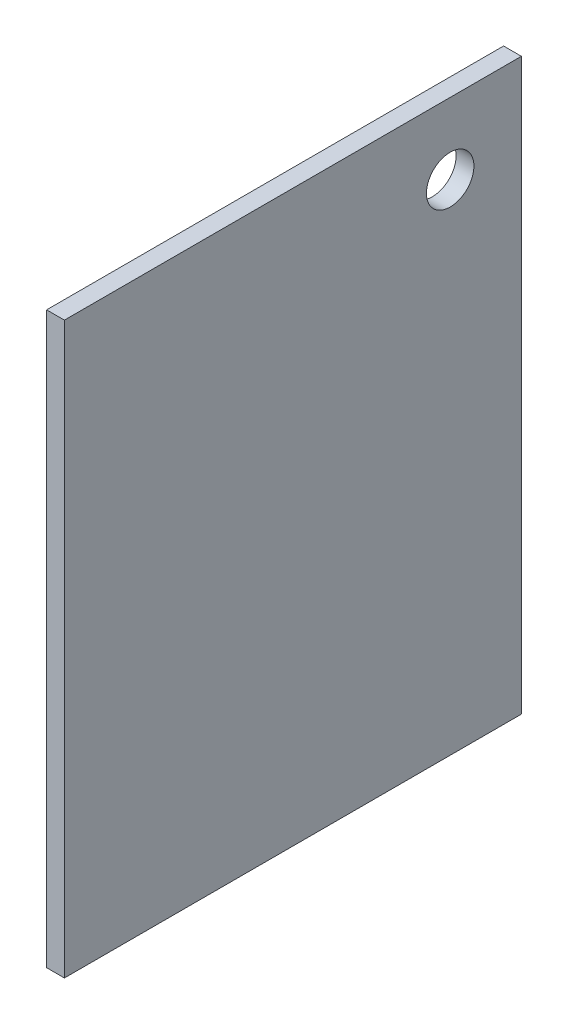
from build123d import *

# Parameters (mm, degrees)
STOCK_BOXV2_1_START     = -19.05
STOCK_BOXV2_1_OUTLINE_W = 19.05
STOCK_BOXV2_1_OUTLINE_H = 488.95
STOCK_BOXV2_1_DEPTH     = 609.6
SKETCH1_R               = 25.4
CUT_EXTRUDE1_DEPTH      = 19.05


# Read off the part's stored shape, not the designer's step: Stock-boxV2-1
with BuildPart() as part:
    # Stock-boxV2-1 outline → Stock-boxV2-1 (new body)
    with BuildSketch(Plane(origin=(0, 0, 0), x_dir=(1, 0, 0), z_dir=(0, 1, 0)).offset(STOCK_BOXV2_1_START)):
        with Locations((-517.525, 0)):
            Rectangle(STOCK_BOXV2_1_OUTLINE_W, STOCK_BOXV2_1_OUTLINE_H)
    extrude(amount=STOCK_BOXV2_1_DEPTH)

    # Sketch1 → Cut-Extrude1 (cut)
    with BuildSketch(Plane(origin=(-508, 0, 0), x_dir=(0, 0, -1), z_dir=(1, 0, 0))):
        with Locations((168.275, 514.35)):
            Circle(SKETCH1_R)
    extrude(amount=-CUT_EXTRUDE1_DEPTH, mode=Mode.SUBTRACT)


solid = part.part
